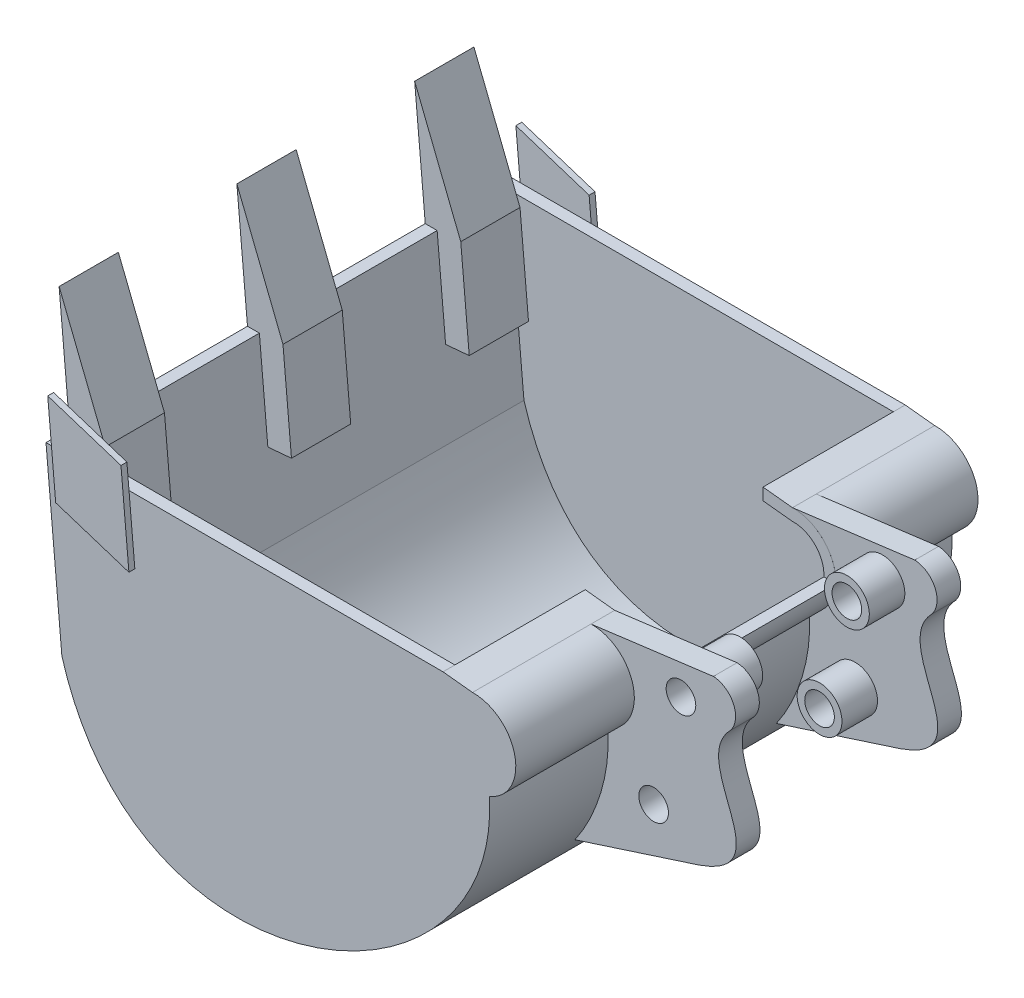
from build123d import *

# Parameters (mm, degrees)
BASIC_GEOMETRY_DEPTH   = 195
REMOVE_MATERIAL_T      = -10
TEETH_START            = 10
TEETH_DEPTH            = 50
SKETCH2_W              = 94.171868374
SKETCH2_H              = 370
REMOVE_MATERIAL2_DEPTH = 50
TEETH_PATTERN_COUNT    = 3
TEETH_PATTERN_PITCH    = 150
SIDE_PLATE_DEPTH       = 5
BOSS_EXTRUDE6_START    = 75
BOSS_EXTRUDE6_DEPTH    = 20
LPATTERN4_START        = -95
LPATTERN4_DEPTH        = 20
SKETCH10_R             = 12.5
CUT_EXTRUDE4_DEPTH     = 485.783096914
SKETCH11_R             = 18.911522993
SKETCH11_R_2           = 12.5
BOSS_EXTRUDE7_DEPTH    = 30
LPATTERN7_COUNT        = 2
LPATTERN7_PITCH        = 120
SKETCH13_W             = 150
SKETCH13_H             = 40
CUT_EXTRUDE5_DEPTH     = 70


# Read off the part's stored shape, not the designer's step: LPattern4
with BuildPart() as part:
    # Sketch1 → Basic_geometry (new, symmetric)
    with BuildSketch(Plane.XY):
        with BuildLine():
            Line((130, 0), (-130, 0))
            Line((-130, 0), (-205, 0))
            Line((-205, 0), (-191.591883356, -149.399539518))
            add(Edge.make_bspline(
                [(-191.591883356, -149.399539518), (-126.425268405, -370.090746117), (179.854093021, -241.359443475), (169.099924805, -71.562234879)],
                knots=[0, 0, 0, 0, 1, 1, 1, 1], degree=3))
            ThreePointArc((169.099924805, -71.562234879), (190.665817888, -31.179766144), (154.858649571, -2.654720612))
            Line((154.858649571, -2.654720612), (130, 0))
        make_face()
    extrude(amount=BASIC_GEOMETRY_DEPTH, both=True)

    # Remove_material
    remove_material_openings = [part.faces().sort_by_distance(p)[0] for p in [
        (-37.5, 0, 0),
    ]]
    offset(amount=REMOVE_MATERIAL_T, openings=remove_material_openings, kind=Kind.INTERSECTION)

    # Sketch7 → Teeth (add)
    with BuildSketch(Plane.XY.offset(-185).offset(TEETH_START)):
        Polygon((-205, 0), (-213.938744429, 99.599693012), (-175.039869809, 1.787748886), (-167.888874266, -77.892005523), (-187.808812868, -79.679754409), (-194.959808411, 0), align=None)
    teeth = extrude(amount=TEETH_DEPTH)

    # Sketch2 → Remove_material2 (cut)
    with BuildSketch(Plane(origin=(0, 0, 0), x_dir=(1, 0, 0), z_dir=(0, 1, 0))):
        with Locations((82.914065813, 0)):
            Rectangle(SKETCH2_W, SKETCH2_H)
    extrude(amount=-REMOVE_MATERIAL2_DEPTH, mode=Mode.SUBTRACT)

    # Teeth_pattern: Teeth ×3
    with Locations(*[(0, 0, i * TEETH_PATTERN_PITCH) for i in range(1, TEETH_PATTERN_COUNT)]):
        add(teeth)

    # Sketch8 → Side_plate (add)
    with BuildSketch(Plane.XY.offset(195)):
        Polygon((-194.959808411, 0), (-198.535306183, 39.839877205), (-136.747557297, 19.919938602), (-134.959808411, 0), (-130.043498975, -54.779831156), (-191.831247861, -34.859892554), align=None)
    side_plate = extrude(amount=SIDE_PLATE_DEPTH)

    # Side_plate_mirror: Side_plate across plane
    add(side_plate.mirror(Plane.XY))

    # Sketch13 → Cut-Extrude5 (cut)
    with BuildSketch(Plane.ZY.offset(-130)):
        with Locations((0, -20)):
            Rectangle(SKETCH13_W, SKETCH13_H)
    extrude(amount=-CUT_EXTRUDE5_DEPTH, mode=Mode.SUBTRACT)


with BuildPart() as body_2:
    # Sketch9 → Boss-Extrude6 (new body)
    with BuildSketch(Plane.XY.offset(BOSS_EXTRUDE6_START)):
        with BuildLine():
            Line((141.296742224, -167.057120142), (245.967438276, -133.233380134))
            add(Edge.make_bspline(
                [(272.594670811, -21.462325491), (235.113232038, -59.333448742), (319.872555968, -107.999027182), (245.967438276, -133.233380134)],
                knots=[0, 0, 0, 0, 1, 1, 1, 1], degree=3))
            ThreePointArc((272.594670811, -21.462325491), (275.102934155, -0.986118764), (258.099927413, 10.695669998))
            Line((258.099927413, 10.695669998), (154.858649571, -2.654720612))
            ThreePointArc((154.858649571, -2.654720612), (190.665817888, -31.179766144), (169.099924805, -71.562234879))
            ThreePointArc((169.099924805, -71.562234879), (163.062439638, -121.599299387), (141.296742224, -167.057120142))
        make_face()
    extrude(amount=BOSS_EXTRUDE6_DEPTH)


with BuildPart() as body_3:
    # LPattern4 outline → LPattern4 (new body)
    with BuildSketch(Plane.XY.offset(LPATTERN4_START)):
        with BuildLine():
            Line((141.296742224, -167.057120142), (245.967438276, -133.233380134))
            add(Edge.make_bspline(
                [(245.967438276, -133.233380134), (319.872555968, -107.999027182), (235.113232038, -59.333448742), (272.594670811, -21.462325491)],
                knots=[0, 0, 0, 0, 1, 1, 1, 1], degree=3))
            ThreePointArc((272.594670811, -21.462325491), (275.102934155, -0.986118764), (258.099927413, 10.695669998))
            Line((258.099927413, 10.695669998), (154.858649571, -2.654720612))
            ThreePointArc((154.858649571, -2.654720612), (190.665817888, -31.179766145), (169.099924805, -71.562234879))
            ThreePointArc((169.099924805, -71.562234879), (163.062439638, -121.599299387), (141.296742224, -167.057120142))
        make_face()
    extrude(amount=LPATTERN4_DEPTH)


with BuildPart() as cut_extrude4_tool:
    # Sketch10 → Cut-Extrude4 (new, through all)
    with BuildSketch(Plane.XY.offset(95)):
        with Locations(Location((230.762415937, -18.047567767, 0), (0, 0, 180))):
            Circle(SKETCH10_R)
        with Locations(Location((207.704013235, -108.047567767, 0), (0, 0, 180))):
            Circle(SKETCH10_R)
    extrude(amount=-CUT_EXTRUDE4_DEPTH)


with BuildPart() as body_2_1:
    add(body_2.part)

    # Cut-Extrude4: cut by cut_extrude4_tool
    add(cut_extrude4_tool.part, mode=Mode.SUBTRACT)

    # Sketch11 → Boss-Extrude7 (add)
    # profile 1 of 2: a face of its own
    with BuildSketch(Plane(origin=(0, 0, 75), x_dir=(-1, 0, 0), z_dir=(0, 0, -1))):
        with Locations((-230.762415937, -18.047567767)):
            Circle(SKETCH11_R)
        with Locations((-230.762415937, -18.047567767)):
            Circle(SKETCH11_R_2, mode=Mode.SUBTRACT)
    # profile 2 of 2: a face of its own
    with BuildSketch(Plane(origin=(0, 0, 75), x_dir=(-1, 0, 0), z_dir=(0, 0, -1))):
        with Locations((-207.704013235, -108.047567767)):
            Circle(SKETCH11_R)
        with Locations((-207.704013235, -108.047567767)):
            Circle(SKETCH11_R_2, mode=Mode.SUBTRACT)
    boss_extrude7 = extrude(amount=BOSS_EXTRUDE7_DEPTH)


with BuildPart() as body_3_1:
    add(body_3.part)

    # Cut-Extrude4: cut by cut_extrude4_tool
    add(cut_extrude4_tool.part, mode=Mode.SUBTRACT)

    # LPattern7: Boss-Extrude7 ×2
    with Locations(*[(0, 0, -i * LPATTERN7_PITCH) for i in range(1, LPATTERN7_COUNT)]):
        add(boss_extrude7)


solid = Compound([part.part, body_2_1.part, body_3_1.part])
